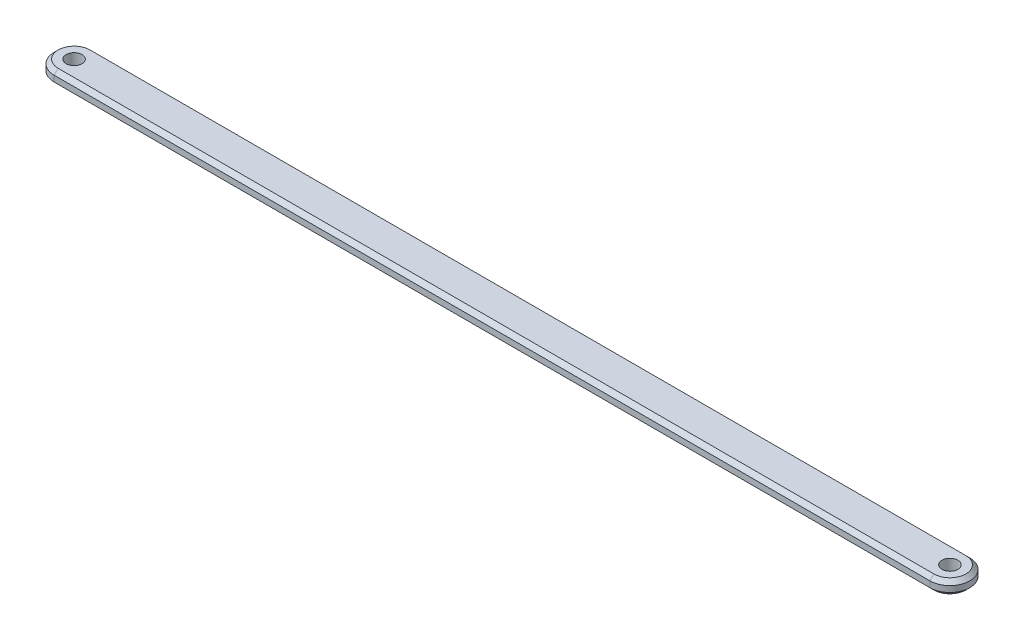
from build123d import *

# Parameters (mm, degrees)
SKETCH_1_R      = 2
EXTRUDE_1_DEPTH = 3.5
CHAMFER_1_SIZE  = 1


with BuildPart() as part:
    # 草图1 → 凸台-拉伸1 (new body)
    with BuildSketch(Plane(origin=(0, 0, 0), x_dir=(1, 0, 0), z_dir=(0, 1, 0))):
        with BuildLine():
            Line((0, 5), (220, 5))
            ThreePointArc((220, 5), (225, 0), (220, -5))
            Line((220, -5), (0, -5))
            ThreePointArc((0, -5), (-5, 0), (0, 5))
        make_face()
        Circle(SKETCH_1_R, mode=Mode.SUBTRACT)
        with Locations((220, 0)):
            Circle(SKETCH_1_R, mode=Mode.SUBTRACT)
    extrude(amount=EXTRUDE_1_DEPTH)

    # 倒角1
    chamfer_1_edges = [part.edges().sort_by_distance(p)[0] for p in [
        (225, 3.5, 0),
        (110, 3.5, -5),
        (110, 3.5, 5),
        (-5, 3.5, 0),
        (225, 0, 0),
        (110, 0, -5),
        (110, 0, 5),
        (-5, 0, 0),
    ]]
    chamfer(chamfer_1_edges, length=CHAMFER_1_SIZE)


solid = part.part
